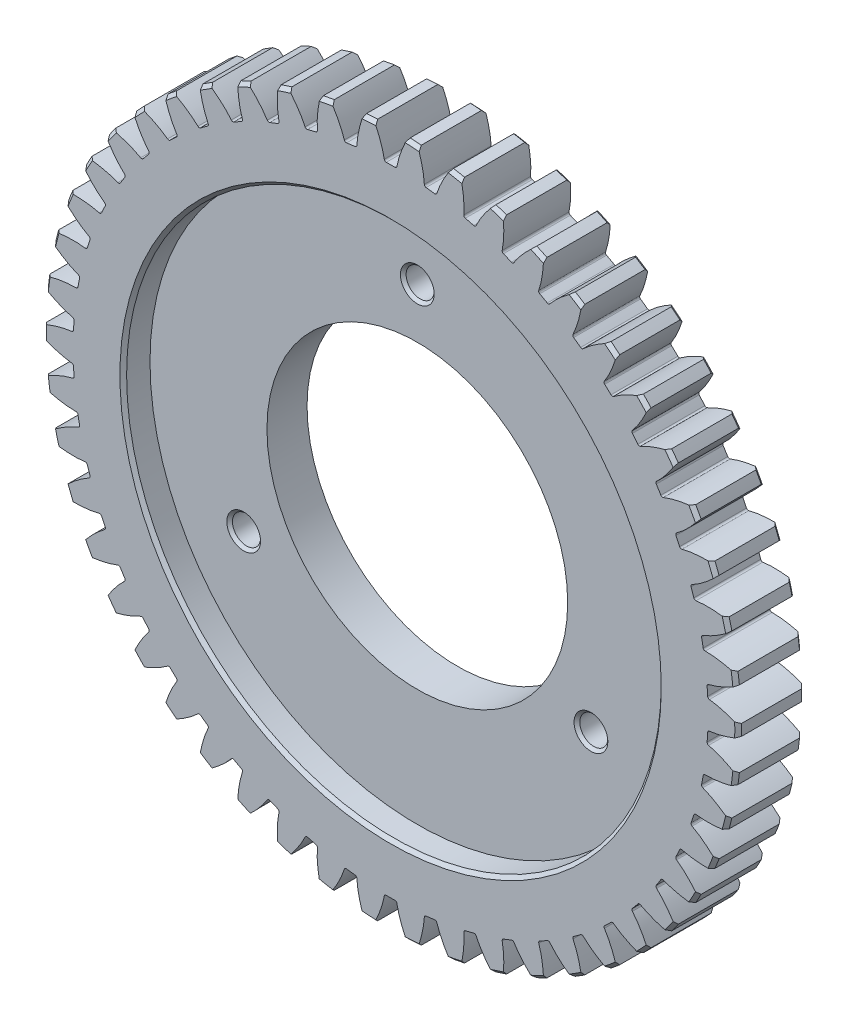
from build123d import *

# Parameters (mm, degrees)
SKETCH_1177_R                    = 52
EXTRUDE_1203_DEPTH               = 5
CHAMFER_1237_SIZE                = 0.5
CUT_EXTRUDE_1630_DEPTH           = 5
FILLET_1_R                       = 0.3
PATTERN_CIRCULAR_1_COUNT         = 50
FILLET_1_OF_PATTERN_CIRCULAR_1_R = 0.3
SKETCH_1_R                       = 40
CUT_EXTRUDE_1_DEPTH              = 4
SKETCH_2_R                       = 22.5
CUT_EXTRUDE_2_DEPTH              = 74.743482784
HOLE_WIZARD_M5_1_D               = 4.2
HOLE_WIZARD_M5_1_CSINK_D         = 5.05
HOLE_WIZARD_M5_1_CSINK_ANGLE     = 90
CHAMFER_1_SIZE                   = 0.5


with BuildPart() as part:
    # Sketch 1177 → Extrude 1203 (new, symmetric)
    with BuildSketch(Plane.XY):
        Circle(SKETCH_1177_R)
    extrude(amount=EXTRUDE_1203_DEPTH, both=True)

    # Chamfer 1237
    chamfer_1237_edges = [part.edges().sort_by_distance(p)[0] for p in [
        (-52, 0, -5),
        (-52, 0, 5),
    ]]
    chamfer(chamfer_1237_edges, length=CHAMFER_1237_SIZE)

    # Sketch 1315 → Cut-Extrude 1630 (cut, symmetric)
    with BuildSketch(Plane.XY):
        with BuildLine():
            ThreePointArc((-0.904830094, 47.491381139), (0, 47.5), (0.904830094, 47.491381139))
            add(Edge.make_bspline(
                [(0.904830094, 47.491381139), (0.911706253, 47.54031168), (0.932307327, 47.677521771), (0.971568727, 47.902229849), (1.051172812, 48.283389304), (1.173833909, 48.769410734), (1.337508953, 49.318752284), (1.547869916, 49.928545283), (1.834446998, 50.66682373), (2.088883788, 51.244008758), (2.290972756, 51.66767574), (2.428738119, 51.943250102)],
                knots=[0.002027097, 0.002027097, 0.002027097, 0.002027097, 0.002027097, 0.002802034, 0.004203051, 0.005604068, 0.008132613, 0.010661158, 0.013189703, 0.015718248, 0.020550166, 0.020550166, 0.020550166, 0.020550166, 0.020550166], degree=4))
            ThreePointArc((2.428738119, 51.943250102), (0, 52), (-2.428738119, 51.943250102))
            add(Edge.make_bspline(
                [(-0.904830094, 47.491381139), (-0.911706253, 47.54031168), (-0.932307327, 47.677521771), (-0.971568727, 47.902229849), (-1.051172812, 48.283389304), (-1.173833909, 48.769410734), (-1.337508953, 49.318752284), (-1.547869916, 49.928545283), (-1.834446998, 50.66682373), (-2.088883788, 51.244008758), (-2.290972756, 51.66767574), (-2.428738119, 51.943250102)],
                knots=[0.002027097, 0.002027097, 0.002027097, 0.002027097, 0.002027097, 0.002802034, 0.004203051, 0.005604068, 0.008132613, 0.010661158, 0.013189703, 0.015718248, 0.020550166, 0.020550166, 0.020550166, 0.020550166, 0.020550166], degree=4))
        make_face()
    cut_extrude_1630 = extrude(amount=CUT_EXTRUDE_1630_DEPTH, both=True, mode=Mode.SUBTRACT)

    # 圆角1
    fillet_1_edges = [part.edges().sort_by_distance(p)[0] for p in [
        (0.904830094, 47.491381139, -2.5),
        (-0.904830094, 47.491381139, -2.5),
    ]]
    fillet(fillet_1_edges, radius=FILLET_1_R)

    # 圆周阵列1: Cut-Extrude 1630 ×50 about axis
    pattern_circular_1_axis = Axis((0, 0, 5), (0, 0, -1))
    for i in range(1, PATTERN_CIRCULAR_1_COUNT):
        add(cut_extrude_1630.rotate(pattern_circular_1_axis, i * 360 / PATTERN_CIRCULAR_1_COUNT), mode=Mode.SUBTRACT)

    # 圆角1 of 圆周阵列1
    fillet_1_of_pattern_circular_1_edges = [part.edges().sort_by_distance(p)[0] for p in [
        (6.849943603, 47.003492132, -2.5),
        (5.054553127, 47.230302695, -2.5),
        (12.687029409, 45.774329976, -2.5),
        (10.934223025, 46.224374164, -2.5),
        (18.324033183, 43.823279292, -2.5),
        (16.641453694, 44.489459639, -2.5),
        (23.672056007, 41.181109315, -2.5),
        (22.086238697, 42.052919759, -2.5),
        (28.646756367, 37.889488643, -2.5),
        (27.182710522, 38.953180213, -2.5),
        (33.169680267, 34.000328101, -2.5),
        (31.850494764, 35.239125745, -2.5),
        (37.169498494, 29.574962075, -2.5),
        (36.015977677, 30.969329214, -2.5),
        (40.583131525, 24.683181229, -2.5),
        (39.613467107, 26.211127861, -2.5),
        (43.35674433, 19.40213187, -2.5),
        (42.586228497, 21.039561363, -2.5),
        (45.446595376, 13.815099302, -2.5),
        (44.887379624, 15.536188415, -2.5),
        (46.819726465, 8.010194364, -2.5),
        (46.48062996, 9.787800494, -2.5),
        (47.454482498, 2.078963877, -2.5),
        (47.340852995, 3.885053113, -2.5),
        (47.340852995, -3.885053113, -2.5),
        (47.454482498, -2.078963877, -2.5),
        (46.48062996, -9.787800494, -2.5),
        (46.819726465, -8.010194364, -2.5),
        (44.887379624, -15.536188415, -2.5),
        (45.446595376, -13.815099302, -2.5),
        (42.586228497, -21.039561363, -2.5),
        (43.35674433, -19.40213187, -2.5),
        (39.613467107, -26.211127861, -2.5),
        (40.583131525, -24.683181229, -2.5),
        (36.015977677, -30.969329214, -2.5),
        (37.169498494, -29.574962075, -2.5),
        (31.850494764, -35.239125745, -2.5),
        (33.169680267, -34.000328101, -2.5),
        (27.182710522, -38.953180213, -2.5),
        (28.646756367, -37.889488643, -2.5),
        (22.086238697, -42.052919759, -2.5),
        (23.672056007, -41.181109315, -2.5),
        (16.641453694, -44.489459639, -2.5),
        (18.324033183, -43.823279292, -2.5),
        (10.934223025, -46.224374164, -2.5),
        (12.687029409, -45.774329976, -2.5),
        (5.054553127, -47.230302695, -2.5),
        (6.849943603, -47.003492132, -2.5),
        (-0.904830094, -47.491381139, -2.5),
        (0.904830094, -47.491381139, -2.5),
        (-6.849943603, -47.003492132, -2.5),
        (-5.054553127, -47.230302695, -2.5),
        (-12.687029409, -45.774329976, -2.5),
        (-10.934223025, -46.224374164, -2.5),
        (-18.324033183, -43.823279292, -2.5),
        (-16.641453694, -44.489459639, -2.5),
        (-23.672056007, -41.181109315, -2.5),
        (-22.086238697, -42.052919759, -2.5),
        (-28.646756367, -37.889488643, -2.5),
        (-27.182710522, -38.953180213, -2.5),
        (-33.169680267, -34.000328101, -2.5),
        (-31.850494764, -35.239125745, -2.5),
        (-37.169498494, -29.574962075, -2.5),
        (-36.015977677, -30.969329214, -2.5),
        (-40.583131525, -24.683181229, -2.5),
        (-39.613467107, -26.211127861, -2.5),
        (-43.35674433, -19.40213187, -2.5),
        (-42.586228497, -21.039561363, -2.5),
        (-45.446595376, -13.815099302, -2.5),
        (-44.887379624, -15.536188415, -2.5),
        (-46.819726465, -8.010194364, -2.5),
        (-46.48062996, -9.787800494, -2.5),
        (-47.454482498, -2.078963877, -2.5),
        (-47.340852995, -3.885053113, -2.5),
        (-47.340852995, 3.885053113, -2.5),
        (-47.454482498, 2.078963877, -2.5),
        (-46.48062996, 9.787800494, -2.5),
        (-46.819726465, 8.010194364, -2.5),
        (-44.887379624, 15.536188415, -2.5),
        (-45.446595376, 13.815099302, -2.5),
        (-42.586228497, 21.039561363, -2.5),
        (-43.35674433, 19.40213187, -2.5),
        (-39.613467107, 26.211127861, -2.5),
        (-40.583131525, 24.683181229, -2.5),
        (-36.015977677, 30.969329214, -2.5),
        (-37.169498494, 29.574962075, -2.5),
        (-31.850494764, 35.239125745, -2.5),
        (-33.169680267, 34.000328101, -2.5),
        (-27.182710522, 38.953180213, -2.5),
        (-28.646756367, 37.889488643, -2.5),
        (-22.086238697, 42.052919759, -2.5),
        (-23.672056007, 41.181109315, -2.5),
        (-16.641453694, 44.489459639, -2.5),
        (-18.324033183, 43.823279292, -2.5),
        (-10.934223025, 46.224374164, -2.5),
        (-12.687029409, 45.774329976, -2.5),
        (-5.054553127, 47.230302695, -2.5),
        (-6.849943603, 47.003492132, -2.5),
    ]]
    fillet(fillet_1_of_pattern_circular_1_edges, radius=FILLET_1_OF_PATTERN_CIRCULAR_1_R)

    # 草图1 → 切除-拉伸1 (cut)
    with BuildSketch(Plane.XY.offset(5)):
        Circle(SKETCH_1_R)
    extrude(amount=-CUT_EXTRUDE_1_DEPTH, mode=Mode.SUBTRACT)

    # 草图2 → 切除-拉伸2 (cut, through all)
    with BuildSketch(Plane.XY.offset(1)):
        Circle(SKETCH_2_R)
    extrude(amount=-CUT_EXTRUDE_2_DEPTH, mode=Mode.SUBTRACT)

    # M5 螺纹孔1 (through all)
    with Locations(Plane.XY.offset(1)):
        with Locations((-25.980762114, -15), (0, 30), (25.980762114, -15)):
            CounterSinkHole(HOLE_WIZARD_M5_1_D / 2, HOLE_WIZARD_M5_1_CSINK_D / 2, counter_sink_angle=HOLE_WIZARD_M5_1_CSINK_ANGLE)

    # 倒角1
    chamfer_1_edges = [part.edges().sort_by_distance(p)[0] for p in [
        (-40, 0, 5),
    ]]
    chamfer(chamfer_1_edges, length=CHAMFER_1_SIZE)


solid = part.part
